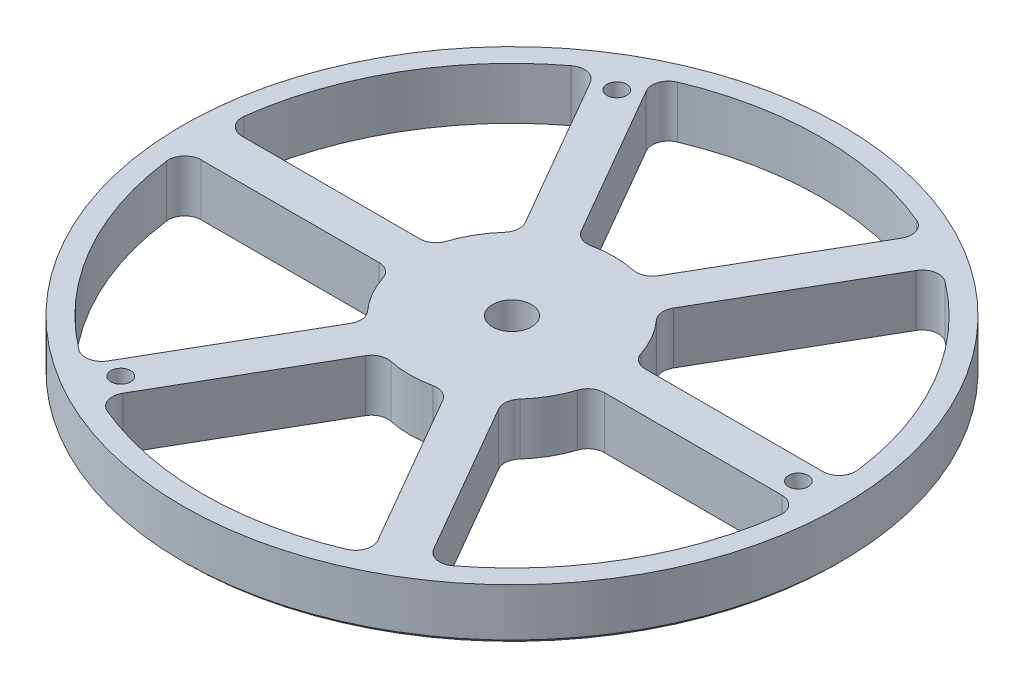
from build123d import *

# Parameters (mm, degrees)
F_12_0_189_DIAMETER_HOLE1_D  = 4.8006
CIRPATTERN3_COUNT            = 3
CUT_EXTRUDE1_DEPTH           = 115.6206569515286
FILLET1_R                    = 4
CIRPATTERN4_COUNT            = 6
FILLET1_OF_CIRPATTERN4_R     = 4
CHAMFER2_SIZE                = 1
F_3_8_0_375_DIAMETER_HOLE1_D = 9.525


with BuildPart() as part:
    # Sketch2 → Revolve1 (revolve)
    with BuildSketch(Plane(origin=(0, 0, 0), x_dir=(0, 0, -1), z_dir=(1, 0, 0))):
        Polygon((0, 0), (-80.55, -9.86e-15), (-80.55, 12.699999999999989), (0, 12.699999999999989), align=None)
    revolve(axis=Axis((0, -0.6350000000000106, 0), (0, 1, 0)))

    # #12 (0.189) Diameter Hole1 (through all)
    with Locations(Plane(origin=(0, 12.699999999999989, 0), x_dir=(1, 0, 0), z_dir=(0, 1, 0))):
        with Locations((-35, 60.621778265)):
            f_12_0_189_diameter_hole1 = Hole(F_12_0_189_DIAMETER_HOLE1_D / 2)

    # CirPattern3: #12 (0.189) Diameter Hole1 ×3 about axis
    cirpattern3_axis = Axis((0, -0.6350000000000106, 0), (0, 1, 0))
    for i in range(1, CIRPATTERN3_COUNT):
        add(f_12_0_189_diameter_hole1.rotate(cirpattern3_axis, i * 360 / CIRPATTERN3_COUNT), mode=Mode.SUBTRACT)

    # Sketch8 → Cut-Extrude1 (cut, through all)
    with BuildSketch(Plane(origin=(0, 12.699999999999989, 0), x_dir=(1, 0, 0), z_dir=(0, 1, 0))):
        with BuildLine():
            Line((-7.91732169499373, 23.713203435596423), (-33.36205552600357, 67.784775215972))
            ThreePointArc((-33.36205552600357, 67.784775215972), (4.63e-15, 75.54999999999998), (33.36205552600357, 67.784775215972))
            Line((33.36205552600357, 67.784775215972), (7.917321694993729, 23.713203435596423))
            ThreePointArc((7.917321694993729, 23.713203435596423), (1.53e-15, 25.000000000000007), (-7.91732169499373, 23.713203435596423))
        make_face()
    cut_extrude1 = extrude(amount=-CUT_EXTRUDE1_DEPTH, mode=Mode.SUBTRACT)

    # Fillet1
    fillet1_edges = [part.edges().sort_by_distance(p)[0] for p in [
        (7.9173216949937295, 6.349999999999994, -23.713203435596427),
        (33.36205552600358, 6.349999999999994, -67.78477521597199),
        (-7.9173216949937295, 6.349999999999994, -23.713203435596427),
        (-33.36205552600357, 6.349999999999994, -67.78477521597199),
    ]]
    fillet(fillet1_edges, radius=FILLET1_R)

    # CirPattern4: Cut-Extrude1 ×6 about axis
    cirpattern4_axis = Axis((0, -0.6350000000000106, 0), (0, 1, 0))
    for i in range(1, CIRPATTERN4_COUNT):
        add(cut_extrude1.rotate(cirpattern4_axis, i * 360 / CIRPATTERN4_COUNT), mode=Mode.SUBTRACT)

    # Fillet1 of CirPattern4
    fillet1_of_cirpattern4_edges = [part.edges().sort_by_distance(p)[0] for p in [
        (-16.577575732838067, 6.349999999999994, -18.713203435596455),
        (-42.022309563847756, 6.349999999999994, -62.78477521597212),
        (-24.4948974278318, 6.349999999999994, -4.999999999999974),
        (-75.38436508985134, 6.349999999999994, -4.999999999999897),
        (-24.494897427831795, 6.349999999999994, 4.999999999999966),
        (-75.38436508985134, 6.349999999999994, 4.999999999999865),
        (-16.57757573283807, 6.349999999999994, 18.713203435596448),
        (-42.02230956384778, 6.349999999999994, 62.78477521597209),
        (-7.917321694993732, 6.349999999999994, 23.713203435596427),
        (-33.36205552600359, 6.349999999999994, 67.78477521597199),
        (7.917321694993727, 6.349999999999994, 23.713203435596427),
        (33.362055526003566, 6.349999999999994, 67.78477521597199),
        (16.577575732838056, 6.349999999999994, 18.713203435596462),
        (42.02230956384773, 6.349999999999994, 62.78477521597213),
        (24.494897427831795, 6.349999999999994, 4.999999999999985),
        (75.38436508985134, 6.349999999999994, 4.999999999999925),
        (24.4948974278318, 6.349999999999994, -4.999999999999974),
        (75.38436508985134, 6.349999999999994, -4.99999999999989),
        (16.577575732838067, 6.349999999999994, -18.713203435596455),
        (42.022309563847756, 6.349999999999994, -62.784775215972104),
    ]]
    fillet(fillet1_of_cirpattern4_edges, radius=FILLET1_OF_CIRPATTERN4_R)

    # Chamfer2
    chamfer2_edges = [part.edges().sort_by_distance(p)[0] for p in [
        (9.86e-15, -9.88e-15, -80.55),
    ]]
    chamfer(chamfer2_edges, length=CHAMFER2_SIZE)

    # 3/8 (0.375) Diameter Hole1 (through all)
    with Locations(Plane(origin=(0, 0, 0), x_dir=(-1, 0, 0), z_dir=(0, -1, 0))):
        with Locations((0, 0)):
            Hole(F_3_8_0_375_DIAMETER_HOLE1_D / 2)


solid = part.part
